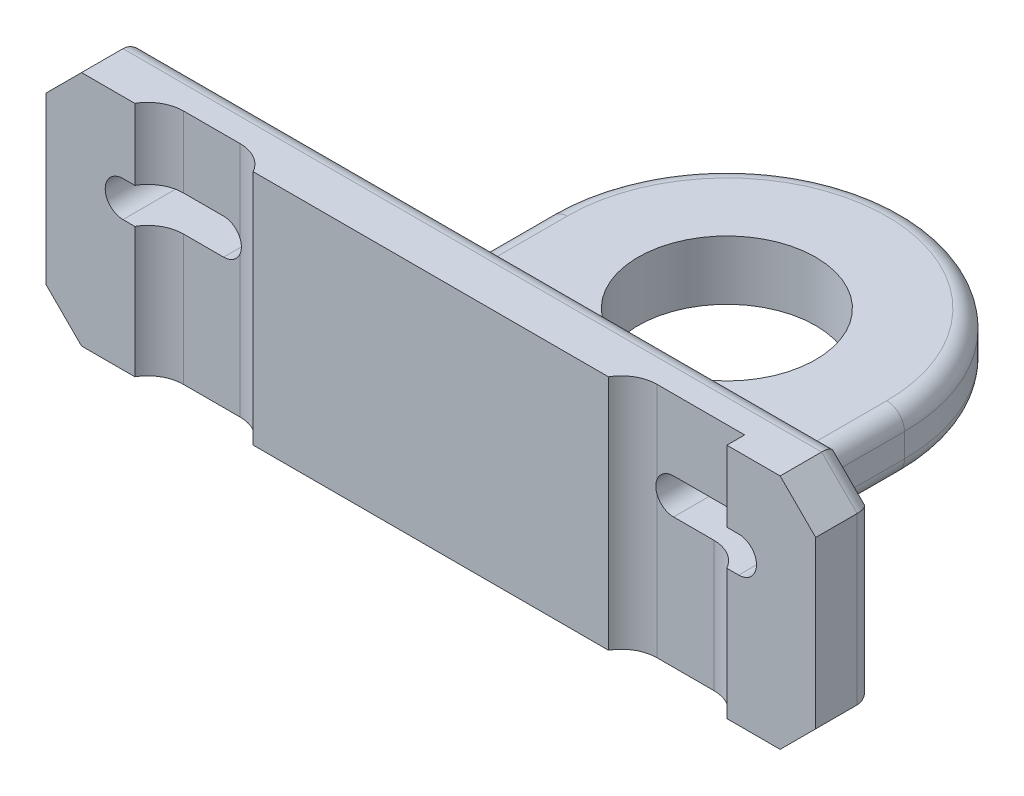
from build123d import *

# Parameters (mm, degrees)
ESQUISSE1_W             = 130
ESQUISSE1_H             = 40
BASE_DEPTH              = 10
CHANFREIN1_SIZE         = 6
CHANFREIN2_SIZE         = 6
LANGUETTE_EXT_DEPTH     = 10
D_GAGEMENT_M31_D        = 30
ENL_V_MAT_EXTRU_1_REACH = 114.29
ESQUISSE5_W             = 20
ESQUISSE5_H             = 3
RAINURE_REACH           = 114.29
CONGES3MM_R             = 3
CONGES6MM_R             = 6


with BuildPart() as part:
    # Esquisse1 → Base (new body)
    with BuildSketch(Plane.XY):
        with Locations((13.160714286, 20)):
            Rectangle(ESQUISSE1_W, ESQUISSE1_H)
    extrude(amount=BASE_DEPTH)

    # Chanfrein1
    chanfrein1_edges = [part.edges().sort_by_distance(p)[0] for p in [
        (78.160714286, 0, 5),
    ]]
    chamfer(chanfrein1_edges, length=CHANFREIN1_SIZE)

    # Chanfrein2
    chanfrein2_edges = [part.edges().sort_by_distance(p)[0] for p in [
        (-51.839285714, 40, 5),
        (78.160714286, 40, 5),
        (-51.839285714, 0, 5),
    ]]
    chamfer(chanfrein2_edges, length=CHANFREIN2_SIZE)

    # languette → Languette_Ext (add)
    with BuildSketch(Plane(origin=(0, 0, 0), x_dir=(1, 0, 0), z_dir=(0, 1, 0))):
        with BuildLine():
            Line((-16.839285714, -10), (-16.839285714, 40))
            ThreePointArc((-16.839285714, 40), (13.160714286, 70), (43.160714286, 40))
            Line((43.160714286, 40), (43.160714286, -10))
            Line((43.160714286, -10), (-16.839285714, -10))
        make_face()
    extrude(amount=LANGUETTE_EXT_DEPTH)

    # Dégagement M31 (through all)
    with Locations(Plane(origin=(0, 0, 0), x_dir=(-1, 0, 0), z_dir=(0, -1, 0))):
        with Locations((-13.160714286, 40)):
            Hole(D_GAGEMENT_M31_D / 2)

    # Esquisse5 → Enlèv. mat.-Extru.1 (cut, up to next)
    with BuildSketch(Plane.XZ, mode=Mode.PRIVATE) as enl_v_mat_extru_1_sk1:
        with Locations((53.160714286, 8.5)):
            Rectangle(ESQUISSE5_W, ESQUISSE5_H)
    enl_v_mat_extru_1_tool1 = extrude(enl_v_mat_extru_1_sk1.sketch, amount=-ENL_V_MAT_EXTRU_1_REACH, mode=Mode.PRIVATE) & part.part
    enl_v_mat_extru_1 = enl_v_mat_extru_1_tool1.solids().sort_by_distance((53.160714, 0, 8.5))[0]
    add(enl_v_mat_extru_1, mode=Mode.SUBTRACT)

    # Symétrie1: Enlèv. mat.-Extru.1 across plane
    add(enl_v_mat_extru_1.mirror(Plane(origin=(13.160714286, 0, 0), x_dir=(0, 0, 1), z_dir=(1, 0, 0))), mode=Mode.SUBTRACT)

    # Esquisse7 → Rainure (cut, up to next)
    with BuildSketch(Plane(origin=(0, 0, 0), x_dir=(-1, 0, 0), z_dir=(0, 0, -1)), mode=Mode.PRIVATE) as rainure_sk1:
        with BuildLine():
            Line((-65.160714286, 28), (-51.160714286, 28))
            ThreePointArc((-51.160714286, 28), (-48.160714286, 25), (-51.160714286, 22))
            Line((-51.160714286, 22), (-65.160714286, 22))
            ThreePointArc((-65.160714286, 22), (-68.160714286, 25), (-65.160714286, 28))
        make_face()
    rainure_tool1 = extrude(rainure_sk1.sketch, amount=-RAINURE_REACH, mode=Mode.PRIVATE) & part.part
    rainure = rainure_tool1.solids().sort_by_distance((58.160714, 25, 0))[0]
    add(rainure, mode=Mode.SUBTRACT)

    # Symétrie2: Rainure across plane
    add(rainure.mirror(Plane(origin=(13.160714286, 0, 0), x_dir=(0, 0, 1), z_dir=(1, 0, 0))), mode=Mode.SUBTRACT)

    # Conges3mm
    conges3mm_edges = [part.edges().sort_by_distance(p)[0] for p in [
        (78.160714286, 20, 0),
        (75.160714286, 3, 0),
        (-51.839285714, 20, 0),
        (-31.339285714, 0, 0),
        (13.160714286, 40, 0),
        (75.160714286, 37, 0),
        (-48.839285714, 3, 0),
        (-48.839285714, 37, 0),
        (57.660714286, 0, 0),
        (13.160714286, 10, 0),
        (-16.839285714, 5, 0),
        (43.160714286, 5, 0),
        (43.160714286, 0, -20),
        (13.160714286, 0, -70),
        (-16.839285714, 0, -20),
        (43.160714286, 10, -20),
        (13.160714286, 10, -70),
        (-16.839285714, 10, -20),
    ]]
    fillet(conges3mm_edges, radius=CONGES3MM_R)

    # Conges6mm
    # the kernel refuses this fillet: 6 mm, written as the material it adds along each edge
    with BuildSketch(Plane(origin=(-36.839285714, 15.009618943, 7), x_dir=(1, 0, 0), z_dir=(0, 1, 0))) as conges6mm_piece_1_section:
        with BuildLine():
            CenterArc((5.196152423, -6), CONGES6MM_R, 90, 60)
            Line((0, -3), (0, 0))
            Line((0, 0), (5.196152423, 0))
        make_face()
    conges6mm_piece_1 = extrude(amount=37.980762114, mode=Mode.PRIVATE)
    conges6mm_piece_1 = split(conges6mm_piece_1, bisect_by=Plane(origin=(-34.649133292, 22, 7.793455272), z_dir=(0, -1, 0)), keep=Keep.TOP, mode=Mode.PRIVATE)
    add(conges6mm_piece_1)
    with BuildSketch(Plane(origin=(-36.839285714, 28, 7), x_dir=(1, 0, 0), z_dir=(0, 1, 0))) as conges6mm_piece_2:
        with BuildLine():
            CenterArc((5.196152423, -6), CONGES6MM_R, 90, 60)
            Line((0, -3), (0, 0))
            Line((0, 0), (5.196152423, 0))
        make_face()
    extrude(amount=12)
    with BuildSketch(Plane(origin=(-36.839285714, 0, 7), x_dir=(1, 0, 0), z_dir=(0, 1, 0))) as conges6mm_piece_3:
        with BuildLine():
            CenterArc((5.196152423, -6), CONGES6MM_R, 90, 60)
            Line((0, -3), (0, 0))
            Line((0, 0), (5.196152423, 0))
        make_face()
    extrude(amount=22)
    with BuildSketch(Plane(origin=(-36.839285714, -12.990381057, 7), x_dir=(1, 0, 0), z_dir=(0, 1, 0))) as conges6mm_piece_4_section:
        with BuildLine():
            CenterArc((5.196152423, -6), CONGES6MM_R, 90, 60)
            Line((0, -3), (0, 0))
            Line((0, 0), (5.196152423, 0))
        make_face()
    conges6mm_piece_4 = extrude(amount=47.980762114, mode=Mode.PRIVATE)
    conges6mm_piece_4 = split(conges6mm_piece_4, bisect_by=Plane(origin=(-34.649133292, 28, 7.793455272), z_dir=(0, 1, 0)), keep=Keep.TOP, mode=Mode.PRIVATE)
    add(conges6mm_piece_4)
    with BuildSketch(Plane(origin=(-16.839285714, 0, 7), x_dir=(0, 0, 1), z_dir=(0, 1, 0))) as conges6mm_piece_5_section:
        with BuildLine():
            CenterArc((6, -5.196152423), CONGES6MM_R, 120, 60)
            Line((0, -5.196152423), (0, 0))
            Line((0, 0), (3, 0))
        make_face()
    conges6mm_piece_5 = extrude(amount=40, mode=Mode.PRIVATE)
    conges6mm_piece_5 = conges6mm_piece_5 - Plane(origin=(-24.839285714, 25, 7.793455272), x_dir=(0, 1, 0), z_dir=(0, 0, -1)) * Cylinder(3, 101, mode=Mode.PRIVATE)
    add(conges6mm_piece_5)
    with BuildSketch(Plane(origin=(43.160714286, 0, 7), x_dir=(1, 0, 0), z_dir=(0, 1, 0))) as conges6mm_piece_6_section:
        with BuildLine():
            CenterArc((5.196152423, -6), CONGES6MM_R, 90, 60)
            Line((0, -3), (0, 0))
            Line((0, 0), (5.196152423, 0))
        make_face()
    conges6mm_piece_6 = extrude(amount=40, mode=Mode.PRIVATE)
    conges6mm_piece_6 = conges6mm_piece_6 - Plane(origin=(51.160714286, 25, 7.793455272), x_dir=(0, 1, 0), z_dir=(0, 0, -1)) * Cylinder(3, 101, mode=Mode.PRIVATE)
    add(conges6mm_piece_6)
    with BuildSketch(Plane(origin=(63.160714286, 0, 7), x_dir=(0, 0, 1), z_dir=(0, 1, 0))) as conges6mm_piece_7:
        with BuildLine():
            CenterArc((6, -5.196152423), CONGES6MM_R, 120, 60)
            Line((0, -5.196152423), (0, 0))
            Line((0, 0), (3, 0))
        make_face()
    extrude(amount=22)


solid = part.part
